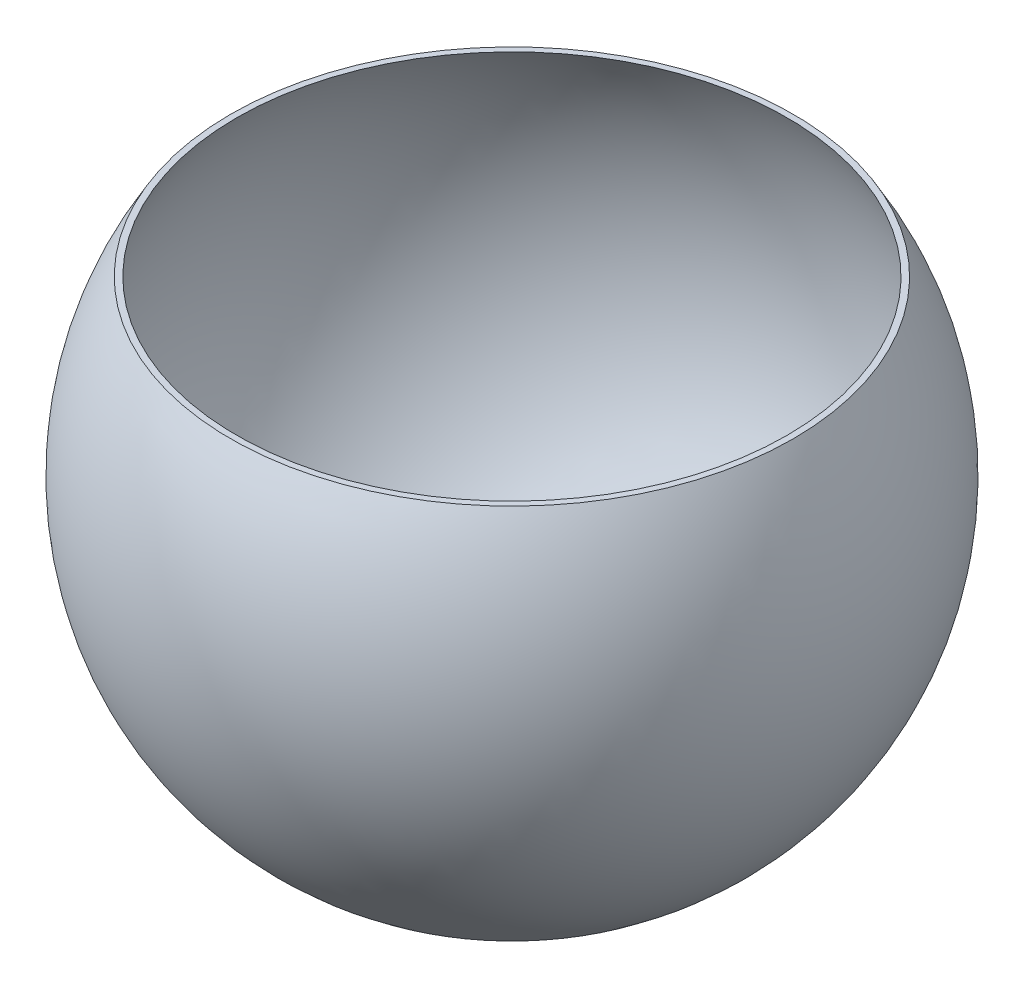
from build123d import *


with BuildPart() as part:
    # Sketch1 → Revolve1 (revolve)
    with BuildSketch(Plane.XY):
        with BuildLine():
            Line((173.362154908, 166.168849687), (169.62958875, 166.168849687))
            ThreePointArc((169.62958875, 166.168849687), (174.94637033, -36.803250087), (0, -139.855222222))
            Line((0, -139.855222222), (0, -143.030222222))
            ThreePointArc((0, -143.030222222), (177.241715479, -39.206347595), (173.362154908, 166.168849687))
        make_face()
    revolve(axis=Axis((0, 0, 0), (0, -1, 0)))


solid = part.part
